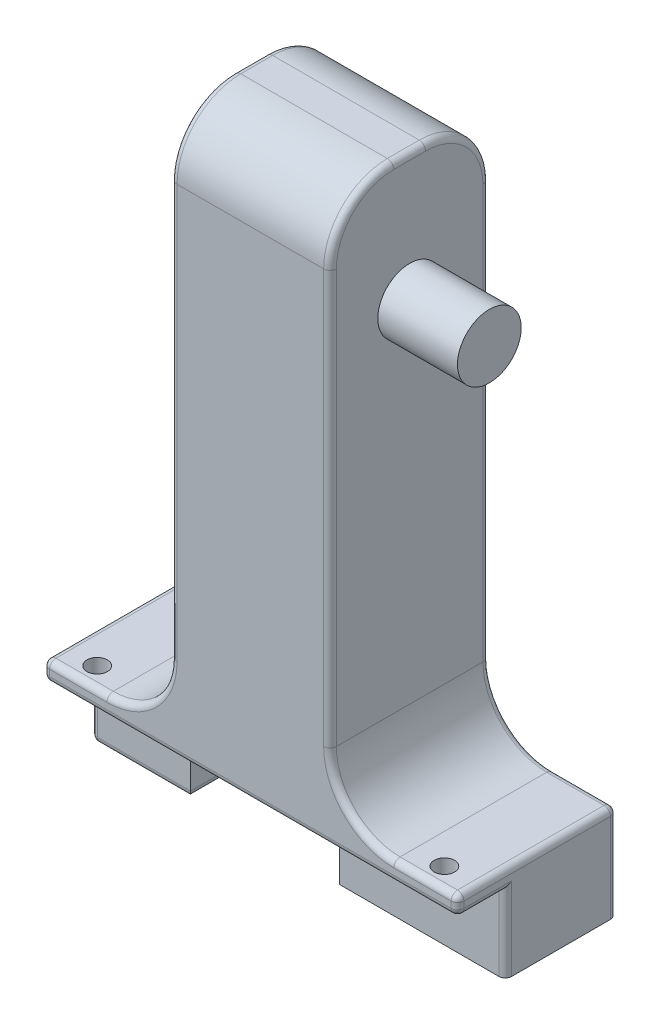
from build123d import *
from build123d.topology import SkipClean

# Parameters (mm, degrees)
SKETCH2_W           = 65
SKETCH2_H           = 25
BOSS_EXTRUDE1_DEPTH = 3
SKETCH3_W           = 15.6
SKETCH3_H           = 17.5
BOSS_EXTRUDE2_DEPTH = 12
SKETCH5_R           = 1.6
CUT_EXTRUDE1_DEPTH  = 38.91437722
SKETCH6_W           = 25
SKETCH6_H           = 25
BOSS_EXTRUDE3_DEPTH = 84.9
SKETCH9_R           = 5
BOSS_EXTRUDE4_DEPTH = 12.5
CUT_EXTRUDE2_DEPTH  = 3
SKETCH11_R          = 5.75
CUT_EXTRUDE3_DEPTH  = 1
FILLET1_R           = 10
FILLET2_R           = 1


with BuildPart() as part:
    # Sketch2 → Boss-Extrude1 (new body)
    with BuildSketch(Plane(origin=(0, 0, 0), x_dir=(1, 0, 0), z_dir=(0, 1, 0))):
        Rectangle(SKETCH2_W, SKETCH2_H)
    extrude(amount=BOSS_EXTRUDE1_DEPTH)

    # Sketch3 → Boss-Extrude2 (add)
    with BuildSketch(Plane.XZ):
        with Locations((-24.7, -3.75)):
            Rectangle(SKETCH3_W, SKETCH3_H)
        Polygon((32.5, 5), (6.5, 5), (6.5, 0), (12.5, 0), (12.5, -12.5), (32.5, -12.5), align=None)
    extrude(amount=BOSS_EXTRUDE2_DEPTH)

    # Sketch5 → Cut-Extrude1 (cut, through all)
    with BuildSketch(Plane(origin=(0, 3, 0), x_dir=(1, 0, 0), z_dir=(0, 1, 0))):
        with Locations(Location((27.234893969, -9.289666573, 0), (0, 0, 270))):
            Circle(SKETCH5_R)
        with Locations(Location((-27.234893969, -9.289666573, 0), (0, 0, 270))):
            Circle(SKETCH5_R)
    extrude(amount=-CUT_EXTRUDE1_DEPTH, mode=Mode.SUBTRACT)

    # Sketch6 → Boss-Extrude3 (add)
    with BuildSketch(Plane(origin=(0, 3, 0), x_dir=(1, 0, 0), z_dir=(0, 1, 0))):
        Rectangle(SKETCH6_W, SKETCH6_H)
    extrude(amount=BOSS_EXTRUDE3_DEPTH)

    # Sketch9 → Boss-Extrude4 (add)
    with BuildSketch(Plane(origin=(12.5, 0, 0), x_dir=(0, 0, -1), z_dir=(1, 0, 0))):
        with Locations(Location((0, 67.9, 0), (0, 0, 180))):
            Circle(SKETCH9_R)
    extrude(amount=BOSS_EXTRUDE4_DEPTH)

    # Sketch10 → Cut-Extrude2 (cut)
    with BuildSketch(Plane.ZY.offset(12.5)):
        with BuildLine():
            Line((-3.75, 72.258898944), (-3.75, 78.758898944))
            Line((-3.75, 78.758898944), (-2.453406208, 85.380414384))
            ThreePointArc((-2.453406208, 85.380414384), (0, 87.4), (2.453406208, 85.380414384))
            Line((2.453406208, 85.380414384), (3.75, 78.758898944))
            Line((3.75, 78.758898944), (3.75, 72.258898944))
            ThreePointArc((3.75, 72.258898944), (5.75, 67.9), (3.75, 63.541101056))
            Line((3.75, 63.541101056), (3.75, 57.041101056))
            Line((3.75, 57.041101056), (2.453406208, 50.419585616))
            ThreePointArc((2.453406208, 50.419585616), (0, 48.4), (-2.453406208, 50.419585616))
            Line((-2.453406208, 50.419585616), (-3.75, 57.041101056))
            Line((-3.75, 57.041101056), (-3.75, 63.541101056))
            ThreePointArc((-3.75, 63.541101056), (-5.75, 67.9), (-3.75, 72.258898944))
        make_face()
    extrude(amount=-CUT_EXTRUDE2_DEPTH, mode=Mode.SUBTRACT)

    # Sketch11 → Cut-Extrude3 (cut)
    with SkipClean():  # the faces are left unmerged after this step: merging them gives an invalid solid
        with BuildSketch(Plane.ZY.offset(9.5)):
            with Locations((0, 67.9)):
                Circle(SKETCH11_R)
        extrude(amount=-CUT_EXTRUDE3_DEPTH, mode=Mode.SUBTRACT)

    # Fillet1
    fillet1_edges = [part.edges().sort_by_distance(p)[0] for p in [
        (12.5, 3, 0),
        (-12.5, 3, 0),
        (0, 87.9, -12.5),
        (0, 87.9, 12.5),
    ]]
    fillet(fillet1_edges, radius=FILLET1_R)

    # Fillet2
    # the kernel refuses this fillet: 1 mm, written as the material it takes off along each edge
    with BuildSketch(Plane(origin=(31.5, 2, 11.5), x_dir=(0, 1, 0), z_dir=(0, 0, 1))) as fillet2_piece_1_section:
        Polygon((0, 0), (FILLET2_R, 0), (FILLET2_R, -FILLET2_R), (0, -FILLET2_R), align=None)
    fillet2_piece_1 = extrude(amount=FILLET2_R, mode=Mode.PRIVATE)
    fillet2_piece_1 = fillet2_piece_1 - Plane(origin=(31.5, 2, 11.5), x_dir=(-0.7071067811865475, -0.7071067811865475, 0), z_dir=(0, 0, 1)) * Sphere(FILLET2_R, mode=Mode.PRIVATE)
    add(fillet2_piece_1, mode=Mode.SUBTRACT)
    with BuildSketch(Plane(origin=(-31.5, 2, 11.5), x_dir=(0, 1, 0), z_dir=(0, 0, 1))) as fillet2_piece_2_section:
        Polygon((0, 0), (FILLET2_R, 0), (FILLET2_R, FILLET2_R), (0, FILLET2_R), align=None)
    fillet2_piece_2 = extrude(amount=FILLET2_R, mode=Mode.PRIVATE)
    fillet2_piece_2 = fillet2_piece_2 - Plane(origin=(-31.5, 2, 11.5), x_dir=(0.7071067811865475, -0.7071067811865475, 0), z_dir=(0, 0, 1)) * Sphere(FILLET2_R, mode=Mode.PRIVATE)
    add(fillet2_piece_2, mode=Mode.SUBTRACT)
    with BuildSketch(Plane(origin=(-31.5, 2, -11.5), x_dir=(0, 1, 0), z_dir=(-1, 0, 0))) as fillet2_piece_3_section:
        Polygon((0, 0), (FILLET2_R, 0), (FILLET2_R, FILLET2_R), (0, FILLET2_R), align=None)
    fillet2_piece_3 = extrude(amount=FILLET2_R, mode=Mode.PRIVATE)
    fillet2_piece_3 = fillet2_piece_3 - Plane(origin=(-31.5, 2, -11.5), x_dir=(0, -0.7071067811865475, 0.7071067811865475), z_dir=(-1, 0, 0)) * Sphere(FILLET2_R, mode=Mode.PRIVATE)
    add(fillet2_piece_3, mode=Mode.SUBTRACT)
    with BuildSketch(Plane(origin=(-31.5, -11, 4), x_dir=(0, 0, 1), z_dir=(-1, 0, 0))) as fillet2_piece_4_section:
        Polygon((0, 0), (FILLET2_R, 0), (FILLET2_R, -FILLET2_R), (0, -FILLET2_R), align=None)
    fillet2_piece_4 = extrude(amount=FILLET2_R, mode=Mode.PRIVATE)
    fillet2_piece_4 = fillet2_piece_4 - Plane(origin=(-31.5, -11, 4), x_dir=(0, 0.7071067811865475, -0.7071067811865475), z_dir=(-1, 0, 0)) * Sphere(FILLET2_R, mode=Mode.PRIVATE)
    add(fillet2_piece_4, mode=Mode.SUBTRACT)
    with BuildSketch(Plane(origin=(-31.5, -11, -11.5), x_dir=(0, 0, -1), z_dir=(-1, 0, 0))) as fillet2_piece_5_section:
        Polygon((0, 0), (FILLET2_R, 0), (FILLET2_R, FILLET2_R), (0, FILLET2_R), align=None)
    fillet2_piece_5 = extrude(amount=FILLET2_R, mode=Mode.PRIVATE)
    fillet2_piece_5 = fillet2_piece_5 - Plane(origin=(-31.5, -11, -11.5), x_dir=(0, 0.7071067811865475, 0.7071067811865475), z_dir=(-1, 0, 0)) * Sphere(FILLET2_R, mode=Mode.PRIVATE)
    add(fillet2_piece_5, mode=Mode.SUBTRACT)
    with BuildSketch(Plane(origin=(-31.5, 1, 11.5), x_dir=(-1, 0, 0), z_dir=(0, 0, 1))) as fillet2_piece_6_section:
        Polygon((0, 0), (FILLET2_R, 0), (FILLET2_R, FILLET2_R), (0, FILLET2_R), align=None)
    fillet2_piece_6 = extrude(amount=FILLET2_R, mode=Mode.PRIVATE)
    fillet2_piece_6 = fillet2_piece_6 - Plane(origin=(-31.5, 1, 11.5), x_dir=(0.7071067811865475, 0.7071067811865475, 0), z_dir=(0, 0, 1)) * Sphere(FILLET2_R, mode=Mode.PRIVATE)
    add(fillet2_piece_6, mode=Mode.SUBTRACT)
    with BuildSketch(Plane(origin=(31.5, 1, 11.5), x_dir=(0, -1, 0), z_dir=(0, 0, 1))) as fillet2_piece_7_section:
        Polygon((0, 0), (FILLET2_R, 0), (FILLET2_R, FILLET2_R), (0, FILLET2_R), align=None)
    fillet2_piece_7 = extrude(amount=FILLET2_R, mode=Mode.PRIVATE)
    fillet2_piece_7 = fillet2_piece_7 - Plane(origin=(31.5, 1, 11.5), x_dir=(-0.7071067811865475, 0.7071067811865475, 0), z_dir=(0, 0, 1)) * Sphere(FILLET2_R, mode=Mode.PRIVATE)
    add(fillet2_piece_7, mode=Mode.SUBTRACT)
    with BuildSketch(Plane(origin=(31.5, 2, -11.5), x_dir=(0, 0, -1), z_dir=(0, 1, 0))) as fillet2_piece_8_section:
        Polygon((0, 0), (FILLET2_R, 0), (FILLET2_R, -FILLET2_R), (0, -FILLET2_R), align=None)
    fillet2_piece_8 = extrude(amount=FILLET2_R, mode=Mode.PRIVATE)
    fillet2_piece_8 = fillet2_piece_8 - Plane(origin=(31.5, 2, -11.5), x_dir=(-0.7071067811865475, 0, 0.7071067811865475), z_dir=(0, 1, 0)) * Sphere(FILLET2_R, mode=Mode.PRIVATE)
    add(fillet2_piece_8, mode=Mode.SUBTRACT)
    with BuildSketch(Plane(origin=(22.5, 3, 12.5), x_dir=(0, -1, 0), z_dir=(1, 0, 0)), Plane(origin=(-31.5, 3, 12.5), x_dir=(0, -1, 0), z_dir=(1, 0, 0))) as fillet2_piece_9:
        with BuildLine():
            CenterArc((FILLET2_R, FILLET2_R), FILLET2_R, 180, 90)
            Line((0, FILLET2_R), (0, 0))
            Line((0, 0), (FILLET2_R, 0))
        make_face()
    extrude(amount=9, mode=Mode.SUBTRACT)
    with BuildSketch(Plane(origin=(22.5, 13, 12.5), x_dir=(-1, 0, 0), z_dir=(0, 1, 0))) as fillet2_piece_10:
        with BuildLine():
            CenterArc((10 + FILLET2_R, -FILLET2_R), FILLET2_R, 90, 90)
            Line((10, -FILLET2_R), (10, 0))
            Line((10, 0), (10 + FILLET2_R, 0))
        make_face()
    revolve(axis=Axis((22.5, 13, 12.5), (0, 0, 1)), revolution_arc=90, mode=Mode.SUBTRACT)
    with BuildSketch(Plane(origin=(12.5, 13, 12.5), x_dir=(-1, 0, 0), z_dir=(0, 1, 0)), Plane(origin=(12.5, 13, -12.5), x_dir=(0, 0, 1), z_dir=(0, 1, 0))) as fillet2_piece_11:
        with BuildLine():
            CenterArc((FILLET2_R, -FILLET2_R), FILLET2_R, 90, 90)
            Line((0, -FILLET2_R), (0, 0))
            Line((0, 0), (FILLET2_R, 0))
        make_face()
    extrude(amount=64.9, mode=Mode.SUBTRACT)
    with BuildSketch(Plane(origin=(12.5, 77.9, 2.5), x_dir=(0, 0, 1), z_dir=(0, -1, 0))) as fillet2_piece_12:
        with BuildLine():
            CenterArc((10 - FILLET2_R, FILLET2_R), FILLET2_R, 270, 90)
            Line((10 - FILLET2_R, 0), (10, 0))
            Line((10, 0), (10, FILLET2_R))
        make_face()
    revolve(axis=Axis((12.5, 77.9, 2.5), (-1, 0, 0)), revolution_arc=90, mode=Mode.SUBTRACT)
    with BuildSketch(Plane(origin=(12.5, 87.9, -2.5), x_dir=(0, -1, 0), z_dir=(0, 0, 1)), Plane(origin=(-12.5, 87.9, 2.5), x_dir=(0, -1, 0), z_dir=(0, 0, -1))) as fillet2_piece_13:
        with BuildLine():
            CenterArc((FILLET2_R, -FILLET2_R), FILLET2_R, 90, 90)
            Line((0, -FILLET2_R), (0, 0))
            Line((0, 0), (FILLET2_R, 0))
        make_face()
    extrude(amount=5, mode=Mode.SUBTRACT)
    with BuildSketch(Plane(origin=(12.5, 77.9, -2.5), x_dir=(0, 1, 0), z_dir=(0, 0, 1))) as fillet2_piece_14:
        with BuildLine():
            CenterArc((10 - FILLET2_R, FILLET2_R), FILLET2_R, 270, 90)
            Line((10, FILLET2_R), (10, 0))
            Line((10, 0), (10 - FILLET2_R, 0))
        make_face()
    revolve(axis=Axis((12.5, 77.9, -2.5), (-1, 0, 0)), revolution_arc=90, mode=Mode.SUBTRACT)
    with BuildSketch(Plane(origin=(22.5, 13, -12.5), x_dir=(-1, 0, 0), z_dir=(0, 1, 0))) as fillet2_piece_15:
        with BuildLine():
            CenterArc((10 + FILLET2_R, FILLET2_R), FILLET2_R, 180, 90)
            Line((10 + FILLET2_R, 0), (10, 0))
            Line((10, 0), (10, FILLET2_R))
        make_face()
    revolve(axis=Axis((22.5, 13, -12.5), (0, 0, 1)), revolution_arc=90, mode=Mode.SUBTRACT)
    with BuildSketch(Plane(origin=(-22.5, 13, 12.5), x_dir=(0, -1, 0), z_dir=(-1, 0, 0))) as fillet2_piece_16:
        with BuildLine():
            CenterArc((10 + FILLET2_R, -FILLET2_R), FILLET2_R, 90, 90)
            Line((10, -FILLET2_R), (10, 0))
            Line((10, 0), (10 + FILLET2_R, 0))
        make_face()
    revolve(axis=Axis((-22.5, 13, 12.5), (0, 0, 1)), revolution_arc=90, mode=Mode.SUBTRACT)
    with BuildSketch(Plane(origin=(-12.5, 13, 12.5), x_dir=(1, 0, 0), z_dir=(0, 1, 0)), Plane(origin=(-12.5, 13, -12.5), x_dir=(0, 0, 1), z_dir=(0, 1, 0))) as fillet2_piece_17:
        with BuildLine():
            CenterArc((FILLET2_R, FILLET2_R), FILLET2_R, 180, 90)
            Line((0, FILLET2_R), (0, 0))
            Line((0, 0), (FILLET2_R, 0))
        make_face()
    extrude(amount=64.9, mode=Mode.SUBTRACT)
    with BuildSketch(Plane(origin=(-12.5, 77.9, 2.5), x_dir=(0, 0, 1), z_dir=(0, -1, 0))) as fillet2_piece_18:
        with BuildLine():
            CenterArc((10 - FILLET2_R, -FILLET2_R), FILLET2_R, 0, 90)
            Line((10, -FILLET2_R), (10, 0))
            Line((10, 0), (10 - FILLET2_R, 0))
        make_face()
    revolve(axis=Axis((-12.5, 77.9, 2.5), (-1, 0, 0)), revolution_arc=90, mode=Mode.SUBTRACT)
    with BuildSketch(Plane(origin=(-12.5, 77.9, -2.5), x_dir=(0, 1, 0), z_dir=(0, 0, 1))) as fillet2_piece_19:
        with BuildLine():
            CenterArc((10 - FILLET2_R, -FILLET2_R), FILLET2_R, 0, 90)
            Line((10, -FILLET2_R), (10, 0))
            Line((10, 0), (10 - FILLET2_R, 0))
        make_face()
    revolve(axis=Axis((-12.5, 77.9, -2.5), (-1, 0, 0)), revolution_arc=90, mode=Mode.SUBTRACT)
    with BuildSketch(Plane(origin=(-22.5, 3, -12.5), x_dir=(0, 0, 1), z_dir=(-1, 0, 0)), Plane(origin=(31.5, 3, -12.5), x_dir=(0, 0, 1), z_dir=(-1, 0, 0))) as fillet2_piece_20:
        with BuildLine():
            CenterArc((FILLET2_R, -FILLET2_R), FILLET2_R, 90, 90)
            Line((0, -FILLET2_R), (0, 0))
            Line((0, 0), (FILLET2_R, 0))
        make_face()
    extrude(amount=9, mode=Mode.SUBTRACT)
    with BuildSketch(Plane(origin=(-22.5, 13, -12.5), x_dir=(0, -1, 0), z_dir=(-1, 0, 0))) as fillet2_piece_21:
        with BuildLine():
            CenterArc((10 + FILLET2_R, FILLET2_R), FILLET2_R, 180, 90)
            Line((10 + FILLET2_R, 0), (10, 0))
            Line((10, 0), (10, FILLET2_R))
        make_face()
    revolve(axis=Axis((-22.5, 13, -12.5), (0, 0, 1)), revolution_arc=90, mode=Mode.SUBTRACT)
    with BuildSketch(Plane(origin=(-31.5, -12, 5), x_dir=(0, 1, 0), z_dir=(1, 0, 0)), Plane(origin=(-14.4, -12, -12.5), x_dir=(0, 1, 0), z_dir=(-1, 0, 0))) as fillet2_piece_22:
        with BuildLine():
            CenterArc((FILLET2_R, -FILLET2_R), FILLET2_R, 90, 90)
            Line((0, -FILLET2_R), (0, 0))
            Line((0, 0), (FILLET2_R, 0))
        make_face()
    extrude(amount=17.1, mode=Mode.SUBTRACT)
    with BuildSketch(Plane(origin=(-16.9, -12, 7.5), x_dir=(-1, 0, 0), z_dir=(0, 0, -1))) as fillet2_piece_23:
        with BuildLine():
            CenterArc((FILLET2_R, FILLET2_R), FILLET2_R, 180, 90)
            Line((0, FILLET2_R), (0, 0))
            Line((0, 0), (FILLET2_R, 0))
        make_face()
    extrude(amount=22.5, mode=Mode.SUBTRACT)
    with BuildSketch(Plane(origin=(-32.5, -12, -11.5), x_dir=(0, 1, 0), z_dir=(0, 0, 1))) as fillet2_piece_24:
        with BuildLine():
            CenterArc((FILLET2_R, -FILLET2_R), FILLET2_R, 90, 90)
            Line((0, -FILLET2_R), (0, 0))
            Line((0, 0), (FILLET2_R, 0))
        make_face()
    extrude(amount=15.5, mode=Mode.SUBTRACT)
    with BuildSketch(Plane(origin=(-32.5, 1, 12.5), x_dir=(1, 0, 0), z_dir=(0, 1, 0))) as fillet2_piece_25:
        with BuildLine():
            CenterArc((FILLET2_R, FILLET2_R), FILLET2_R, 180, 90)
            Line((0, FILLET2_R), (0, 0))
            Line((0, 0), (FILLET2_R, 0))
        make_face()
    extrude(amount=1, mode=Mode.SUBTRACT)
    with BuildSketch(Plane(origin=(-32.5, 0, 5), x_dir=(0, 0, -1), z_dir=(0, -1, 0))) as fillet2_piece_26:
        with BuildLine():
            CenterArc((FILLET2_R, FILLET2_R), FILLET2_R, 180, 90)
            Line((0, FILLET2_R), (0, 0))
            Line((0, 0), (FILLET2_R, 0))
        make_face()
    extrude(amount=11, mode=Mode.SUBTRACT)
    with BuildSketch(Plane(origin=(-32.5, 0, 5), x_dir=(0, 1, 0), z_dir=(0, 0, 1))) as fillet2_piece_27:
        with BuildLine():
            CenterArc((FILLET2_R, -FILLET2_R), FILLET2_R, 90, 90)
            Line((0, -FILLET2_R), (0, 0))
            Line((0, 0), (FILLET2_R, 0))
        make_face()
    extrude(amount=6.5, mode=Mode.SUBTRACT)
    with BuildSketch(Plane(origin=(32.5, 1, 12.5), x_dir=(-1, 0, 0), z_dir=(0, 1, 0))) as fillet2_piece_28:
        with BuildLine():
            CenterArc((FILLET2_R, -FILLET2_R), FILLET2_R, 90, 90)
            Line((0, -FILLET2_R), (0, 0))
            Line((0, 0), (FILLET2_R, 0))
        make_face()
    extrude(amount=1, mode=Mode.SUBTRACT)
    with BuildSketch(Plane(origin=(32.5, 0, 5), x_dir=(0, 0, -1), z_dir=(0, -1, 0))) as fillet2_piece_29:
        with BuildLine():
            CenterArc((FILLET2_R, -FILLET2_R), FILLET2_R, 90, 90)
            Line((0, -FILLET2_R), (0, 0))
            Line((0, 0), (FILLET2_R, 0))
        make_face()
    extrude(amount=14.5, mode=Mode.SUBTRACT)
    with BuildSketch(Plane(origin=(32.5, 0, 11.5), x_dir=(-1, 0, 0), z_dir=(0, 0, -1))) as fillet2_piece_30:
        with BuildLine():
            CenterArc((FILLET2_R, FILLET2_R), FILLET2_R, 180, 90)
            Line((0, FILLET2_R), (0, 0))
            Line((0, 0), (FILLET2_R, 0))
        make_face()
    extrude(amount=6.5, mode=Mode.SUBTRACT)
    with BuildSketch(Plane(origin=(-31.5, 0, 12.5), x_dir=(0, 1, 0), z_dir=(1, 0, 0))) as fillet2_piece_31:
        with BuildLine():
            CenterArc((FILLET2_R, -FILLET2_R), FILLET2_R, 90, 90)
            Line((0, -FILLET2_R), (0, 0))
            Line((0, 0), (FILLET2_R, 0))
        make_face()
    extrude(amount=63, mode=Mode.SUBTRACT)
    with BuildSketch(Plane(origin=(-32.5, 2, -12.5), x_dir=(0, 0, 1), z_dir=(0, -1, 0))) as fillet2_piece_32:
        with BuildLine():
            CenterArc((FILLET2_R, -FILLET2_R), FILLET2_R, 90, 90)
            Line((0, -FILLET2_R), (0, 0))
            Line((0, 0), (FILLET2_R, 0))
        make_face()
    extrude(amount=13, mode=Mode.SUBTRACT)
    with BuildSketch(Plane(origin=(-32.5, 3, -11.5), x_dir=(1, 0, 0), z_dir=(0, 0, 1))) as fillet2_piece_33:
        with BuildLine():
            CenterArc((FILLET2_R, -FILLET2_R), FILLET2_R, 90, 90)
            Line((0, -FILLET2_R), (0, 0))
            Line((0, 0), (FILLET2_R, 0))
        make_face()
    extrude(amount=23, mode=Mode.SUBTRACT)
    with BuildSketch(Plane(origin=(32.5, 3, 11.5), x_dir=(0, -1, 0), z_dir=(0, 0, -1))) as fillet2_piece_34:
        with BuildLine():
            CenterArc((FILLET2_R, FILLET2_R), FILLET2_R, 180, 90)
            Line((0, FILLET2_R), (0, 0))
            Line((0, 0), (FILLET2_R, 0))
        make_face()
    extrude(amount=23, mode=Mode.SUBTRACT)
    with BuildSketch(Plane(origin=(32.5, -14.5, -12.5), x_dir=(0, 0, 1), z_dir=(0, 1, 0))) as fillet2_piece_35:
        with BuildLine():
            CenterArc((FILLET2_R, -FILLET2_R), FILLET2_R, 90, 90)
            Line((0, -FILLET2_R), (0, 0))
            Line((0, 0), (FILLET2_R, 0))
        make_face()
    extrude(amount=16.5, mode=Mode.SUBTRACT)
    with BuildSketch(Plane(origin=(-32.5, 0, 2.5), x_dir=(0, 1, 0), z_dir=(0, 0, 1))) as fillet2_piece_36a_section:
        with BuildLine():
            CenterArc((FILLET2_R, -FILLET2_R), FILLET2_R, 90, 90)
            Line((0, -FILLET2_R), (0, 0))
            Line((0, 0), (FILLET2_R, 0))
        make_face()
    fillet2_piece_36a = extrude(amount=9, mode=Mode.PRIVATE)
    fillet2_piece_36a = split(fillet2_piece_36a, bisect_by=Plane(origin=(-32.273604886, 0.226395114, 5), z_dir=(0, 0, -1)), keep=Keep.TOP, mode=Mode.PRIVATE)
    with BuildSketch(Plane(origin=(-32.5, 2.5, 5), x_dir=(0, 0, -1), z_dir=(0, -1, 0))) as fillet2_piece_36b_section:
        with BuildLine():
            CenterArc((FILLET2_R, FILLET2_R), FILLET2_R, 180, 90)
            Line((0, FILLET2_R), (0, 0))
            Line((0, 0), (FILLET2_R, 0))
        make_face()
    fillet2_piece_36b = extrude(amount=13.5, mode=Mode.PRIVATE)
    fillet2_piece_36b = split(fillet2_piece_36b, bisect_by=Plane(origin=(-32.273604886, 0, 4.773604886), z_dir=(0, 1, 0)), keep=Keep.TOP, mode=Mode.PRIVATE)
    fillet2_piece_36 = fillet2_piece_36a & fillet2_piece_36b
    add(fillet2_piece_36, mode=Mode.SUBTRACT)
    with BuildSketch(Plane(origin=(32.5, 0, 11.5), x_dir=(-1, 0, 0), z_dir=(0, 0, -1))) as fillet2_piece_37a_section:
        with BuildLine():
            CenterArc((FILLET2_R, FILLET2_R), FILLET2_R, 180, 90)
            Line((0, FILLET2_R), (0, 0))
            Line((0, 0), (FILLET2_R, 0))
        make_face()
    fillet2_piece_37a = extrude(amount=9, mode=Mode.PRIVATE)
    fillet2_piece_37a = split(fillet2_piece_37a, bisect_by=Plane(origin=(32.273604886, 0.226395114, 5), z_dir=(0, 0, -1)), keep=Keep.TOP, mode=Mode.PRIVATE)
    with BuildSketch(Plane(origin=(32.5, 2.5, 5), x_dir=(0, 0, -1), z_dir=(0, -1, 0))) as fillet2_piece_37b_section:
        with BuildLine():
            CenterArc((FILLET2_R, -FILLET2_R), FILLET2_R, 90, 90)
            Line((0, -FILLET2_R), (0, 0))
            Line((0, 0), (FILLET2_R, 0))
        make_face()
    fillet2_piece_37b = extrude(amount=17, mode=Mode.PRIVATE)
    fillet2_piece_37b = split(fillet2_piece_37b, bisect_by=Plane(origin=(32.273604886, 0, 4.773604886), z_dir=(0, 1, 0)), keep=Keep.TOP, mode=Mode.PRIVATE)
    fillet2_piece_37 = fillet2_piece_37a & fillet2_piece_37b
    add(fillet2_piece_37, mode=Mode.SUBTRACT)


solid = part.part
